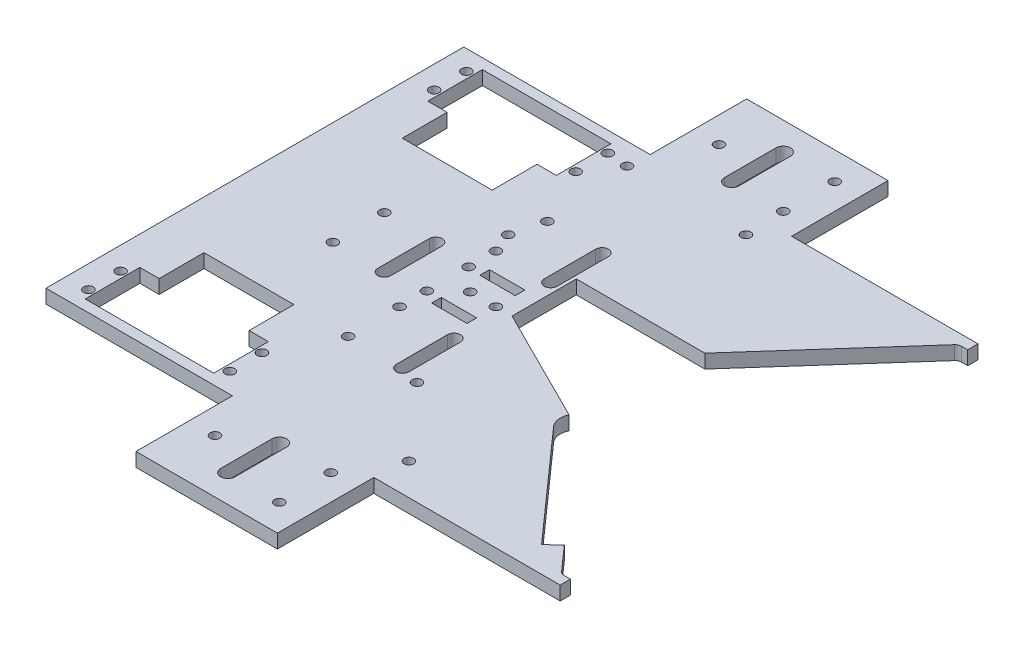
from build123d import *

# Parameters (mm, degrees)
BOSS_EXTRUDE1_DEPTH = 4.3
CUT_EXTRUDE1_DEPTH  = 4.5
FILLET1_R           = 2
CUT_EXTRUDE2_DEPTH  = 10
SKETCH8_R           = 1.5
CUT_EXTRUDE3_DEPTH  = 10
SKETCH9_R           = 1.5
CUT_EXTRUDE4_DEPTH  = 10
CUT_EXTRUDE5_DEPTH  = 10
SKETCH11_R          = 1.5
CUT_EXTRUDE6_DEPTH  = 10
SKETCH12_R          = 1.5
CUT_EXTRUDE7_DEPTH  = 10
SKETCH7_R           = 1.5
SKETCH7_W           = 11
SKETCH7_H           = 3
CUT_EXTRUDE8_DEPTH  = 9
SKETCH13_R          = 1.5
CUT_EXTRUDE9_DEPTH  = 10
SKETCH14_R          = 1.5
CUT_EXTRUDE10_DEPTH = 10


with BuildPart() as part:
    # Sketch2 → Boss-Extrude1 (new body)
    with BuildSketch(Plane(origin=(0, 0, 0), x_dir=(1, 0, 0), z_dir=(0, 1, 0))):
        Polygon((0, 0), (0, 65), (58, 65), (58, 95), (102, 95), (102, 65), (160, 65), (160, 0), align=None)
    extrude(amount=BOSS_EXTRUDE1_DEPTH)

    # Mirror1: part across plane


with BuildPart() as part_1:
    add(part.part)
    add(part.part.mirror(Plane(origin=(0, 4.3, 0), x_dir=(1, 0, 0), z_dir=(0, 0, -1))))

    # Sketch3 → Cut-Extrude1 (cut)
    with BuildSketch(Plane(origin=(0, 4.3, 0), x_dir=(1, 0, 0), z_dir=(0, 1, 0))):
        Polygon((160, -61.8), (160, 61.8), (157.156451185, 61.8), (120.012594795, 20), (80.012594795, 20), (80.012594795, 0), (120, -20), (157.155555556, -61.8), align=None)
    extrude(amount=-CUT_EXTRUDE1_DEPTH, mode=Mode.SUBTRACT)

    # Fillet1
    fillet1_edges = [part_1.edges().sort_by_distance(p)[0] for p in [
        (157.156451185, 2.15, -61.8),
        (157.155555556, 2.15, 61.8),
    ]]
    fillet(fillet1_edges, radius=FILLET1_R)

    # Sketch6 → Cut-Extrude2 (cut)
    with BuildSketch(Plane(origin=(0, 4.3, 0), x_dir=(1, 0, 0), z_dir=(0, 1, 0))):
        Polygon((9, -61.8), (49, -61.8), (49, -44.8), (43, -44.8), (43, -30.841820122), (15, -30.841820122), (15, -44.8), (9, -44.8), align=None)
        Polygon((9, 44.8), (15, 44.8), (15, 30.841820122), (43, 30.841820122), (43, 44.8), (49, 44.8), (49, 61.8), (9, 61.8), align=None)
    extrude(amount=-CUT_EXTRUDE2_DEPTH, mode=Mode.SUBTRACT)

    # Sketch8 → Cut-Extrude3 (cut)
    with BuildSketch(Plane(origin=(0, 4.3, 0), x_dir=(1, 0, 0), z_dir=(0, 1, 0))):
        with Locations((7, 58.8)):
            Circle(SKETCH8_R)
        with Locations((7, 48.8)):
            Circle(SKETCH8_R)
        with Locations((51, 48.8)):
            Circle(SKETCH8_R)
        with Locations((51, 58.8)):
            Circle(SKETCH8_R)
        with Locations((7, -48.8)):
            Circle(SKETCH8_R)
        with Locations((7, -58.8)):
            Circle(SKETCH8_R)
        with Locations((51, -58.8)):
            Circle(SKETCH8_R)
        with Locations((51, -48.8)):
            Circle(SKETCH8_R)
    extrude(amount=-CUT_EXTRUDE3_DEPTH, mode=Mode.SUBTRACT)

    # Sketch9 → Cut-Extrude4 (cut)
    with BuildSketch(Plane.XZ):
        with Locations((94, 70.4)):
            Circle(SKETCH9_R)
        with Locations((66, 78.4)):
            Circle(SKETCH9_R)
        with Locations((66, -78.4)):
            Circle(SKETCH9_R)
        with Locations((94, -86.4)):
            Circle(SKETCH9_R)
        with Locations((94, 86.4)):
            Circle(SKETCH9_R)
        with Locations((94, -70.4)):
            Circle(SKETCH9_R)
        with BuildLine():
            Line((75.75, 70.4), (75.75, 86.4))
            ThreePointArc((75.75, 86.4), (78, 88.65), (80.25, 86.4))
            Line((80.25, 86.4), (80.25, 70.4))
            ThreePointArc((80.25, 70.4), (78, 68.15), (75.75, 70.4))
        make_face()
        with BuildLine():
            Line((75.75, -86.4), (75.75, -70.4))
            ThreePointArc((75.75, -70.4), (78, -68.15), (80.25, -70.4))
            Line((80.25, -70.4), (80.25, -86.4))
            ThreePointArc((80.25, -86.4), (78, -88.65), (75.75, -86.4))
        make_face()
    extrude(amount=-CUT_EXTRUDE4_DEPTH, mode=Mode.SUBTRACT)

    # Sketch10 → Cut-Extrude5 (cut)
    with BuildSketch(Plane(origin=(0, 4.3, 0), x_dir=(1, 0, 0), z_dir=(0, 1, 0))):
        with BuildLine():
            Line((123.321819194, -23.737046593), (149.896372747, -53.633419341))
            Line((149.896372747, -53.633419341), (146.159326154, -56.955238535))
            Line((146.159326154, -56.955238535), (116.262953407, -23.321819194))
            ThreePointArc((116.262953407, -23.321819194), (120.29361011, -15.008628134), (123.321819194, -23.737046593))
        make_face()
    extrude(amount=-CUT_EXTRUDE5_DEPTH, mode=Mode.SUBTRACT)

    # Sketch11 → Cut-Extrude6 (cut)
    with BuildSketch(Plane.XZ):
        with BuildLine():
            ThreePointArc((79, 31.031280577), (77, 33.031280577), (75, 31.031280577))
            Line((75, 31.031280577), (75, 15.031280577))
            ThreePointArc((75, 15.031280577), (77, 13.031280577), (79, 15.031280577))
            Line((79, 15.031280577), (79, 31.031280577))
        make_face()
        with BuildLine():
            ThreePointArc((75, -31.031280577), (77, -33.031280577), (79, -31.031280577))
            Line((79, -31.031280577), (79, -15.031280577))
            ThreePointArc((79, -15.031280577), (77, -13.031280577), (75, -15.031280577))
            Line((75, -15.031280577), (75, -31.031280577))
        make_face()
        with Locations((60, 31)):
            Circle(SKETCH11_R)
        with Locations((60, 15)):
            Circle(SKETCH11_R)
        with Locations((60, -15)):
            Circle(SKETCH11_R)
        with Locations((60, -31)):
            Circle(SKETCH11_R)
    extrude(amount=-CUT_EXTRUDE6_DEPTH, mode=Mode.SUBTRACT)

    # Sketch12 → Cut-Extrude7 (cut)
    with BuildSketch(Plane(origin=(0, 0, 0), x_dir=(-1, 0, 0), z_dir=(0, -1, 0))):
        with BuildLine():
            ThreePointArc((-50.262723036, -8), (-48.262723036, -10), (-46.262723036, -8))
            Line((-46.262723036, -8), (-46.262723036, 8))
            ThreePointArc((-46.262723036, 8), (-48.262723036, 10), (-50.262723036, 8))
            Line((-50.262723036, 8), (-50.262723036, -8))
        make_face()
        with Locations((-32.262723036, -8)):
            Circle(SKETCH12_R)
        with Locations((-32.262723036, 8)):
            Circle(SKETCH12_R)
    extrude(amount=-CUT_EXTRUDE7_DEPTH, mode=Mode.SUBTRACT)

    # Sketch7 → Cut-Extrude8 (cut)
    with BuildSketch(Plane(origin=(0, 4.3, 0), x_dir=(1, 0, 0), z_dir=(0, 1, 0))):
        with Locations((60.012594795, -6.5)):
            Circle(SKETCH7_R)
        with Locations((60.012594795, 6.5)):
            Circle(SKETCH7_R)
        with Locations((69.5, -7.5)):
            Rectangle(SKETCH7_W, SKETCH7_H)
        with Locations((69.5, 7.5)):
            Rectangle(SKETCH7_W, SKETCH7_H)
    extrude(amount=-CUT_EXTRUDE8_DEPTH, mode=Mode.SUBTRACT)

    # Sketch13 → Cut-Extrude9 (cut)
    with BuildSketch(Plane(origin=(0, 4.3, 0), x_dir=(1, 0, 0), z_dir=(0, 1, 0))):
        with Locations((75, 0)):
            Circle(SKETCH13_R)
        with Locations((67, 0)):
            Circle(SKETCH13_R)
    extrude(amount=-CUT_EXTRUDE9_DEPTH, mode=Mode.SUBTRACT)

    # Sketch14 → Cut-Extrude10 (cut)
    with BuildSketch(Plane(origin=(0, 4.3, 0), x_dir=(1, 0, 0), z_dir=(0, 1, 0))):
        with Locations((57.5, 58.3)):
            Circle(SKETCH14_R)
        with Locations((94.5, 58.3)):
            Circle(SKETCH14_R)
        with Locations((57.5, 21.3)):
            Circle(SKETCH14_R)
        with Locations((83.127806945, -32.705958418)):
            Circle(SKETCH14_R)
        with Locations((103.05872211, -55.128237978)):
            Circle(SKETCH14_R)
    extrude(amount=-CUT_EXTRUDE10_DEPTH, mode=Mode.SUBTRACT)


solid = part_1.part
